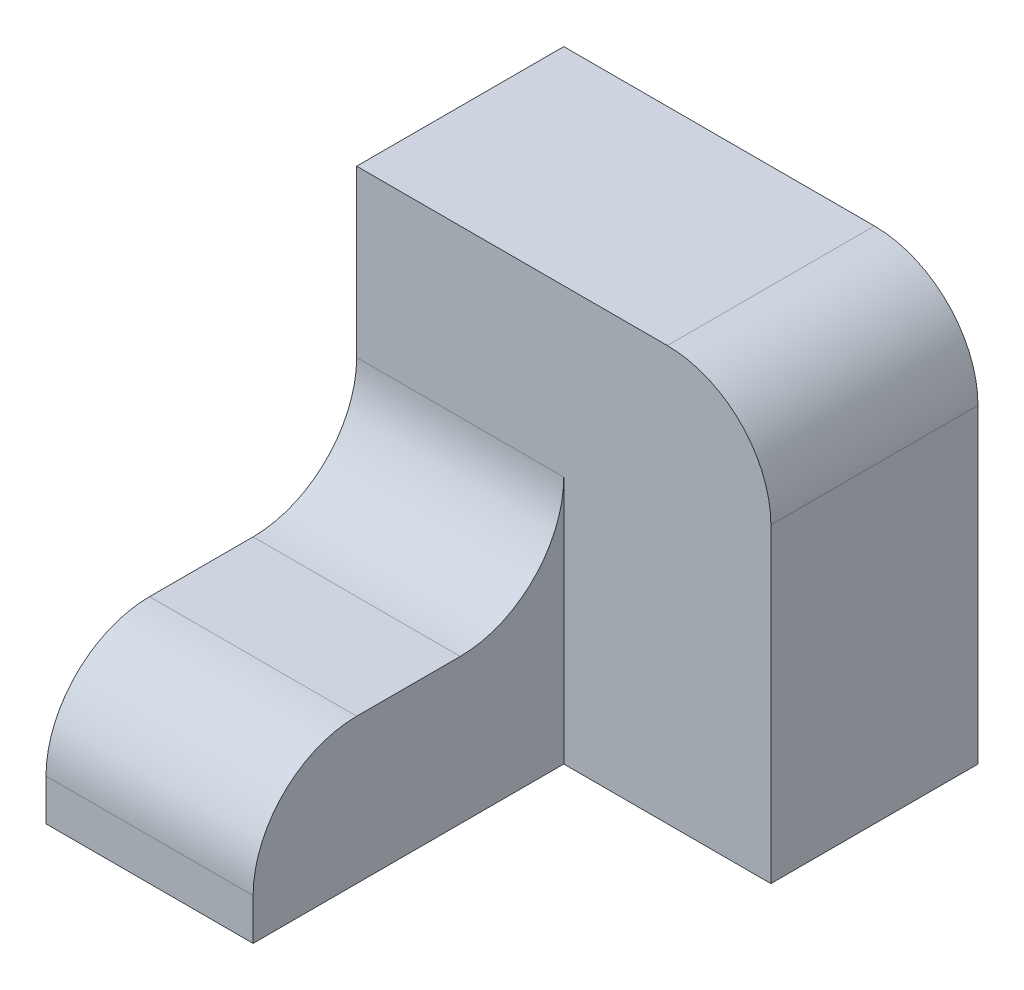
from build123d import *

# Parameters (mm, degrees)
SKETCH1_W           = 20
SKETCH1_H           = 14
BOSS_EXTRUDE1_DEPTH = 30
SKETCH2_W           = 40
SKETCH2_H           = 40
BOSS_EXTRUDE2_DEPTH = 20
FILLET1_R           = 10


with BuildPart() as part:
    # Sketch1 → Boss-Extrude1 (new body)
    with BuildSketch(Plane.XY):
        with Locations((-20, -7)):
            Rectangle(SKETCH1_W, SKETCH1_H)
    extrude(amount=BOSS_EXTRUDE1_DEPTH)

    # Sketch2 → Boss-Extrude2 (add)
    with BuildSketch(Plane.XY):
        with Locations((-10, 6)):
            Rectangle(SKETCH2_W, SKETCH2_H)
    extrude(amount=-BOSS_EXTRUDE2_DEPTH)

    # Fillet1
    fillet1_edges = [part.edges().sort_by_distance(p)[0] for p in [
        (-20, 0, 0),
        (10, 26, -10),
        (-20, 0, 30),
    ]]
    fillet(fillet1_edges, radius=FILLET1_R)


solid = part.part
